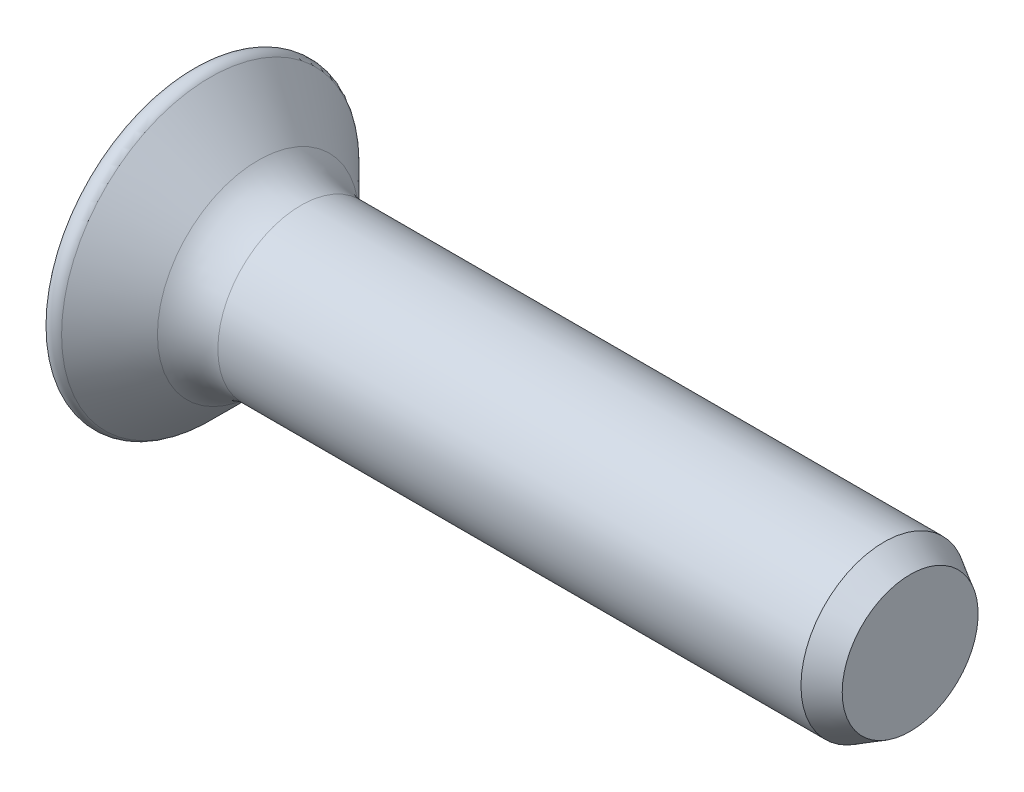
from build123d import *

# Parameters (mm, degrees)
CHAMFER1_SIZE      = 0.2
CHAMFER1_SIZE2     = 0.346410162
CUT_EXTRUDE1_DEPTH = 0.8
CUT_EXTRUDE1_TAPER = 6
FILLET1_R          = 0.8


with BuildPart() as part:
    # Sketch1 → Revolve1 (revolve)
    with BuildSketch(Plane.XY):
        with BuildLine():
            Line((-1.6, 0), (8.4, 0))
            Line((8.4, 0), (8.4, 1.1))
            Line((8.4, 1.1), (0, 1.1))
            Line((0, 1.1), (-0.869043005, 1.969043005))
            ThreePointArc((-0.869043005, 1.969043005), (-0.992640239, 2.010371092), (-1.1, 1.936491673))
            ThreePointArc((-1.1, 1.936491673), (-1.472983346, 1), (-1.6, 0))
        make_face()
    revolve(axis=Axis((0, 0, 0), (1, 0, 0)))

    # Chamfer1
    chamfer1_edges = [part.edges().sort_by_distance(p)[0] for p in [
        (8.4, -1.1, 0),
    ]]
    chamfer1_side = [part.faces().sort_by_distance(p)[0] for p in [
        (8.4, 0, 0),
    ]]
    chamfer(chamfer1_edges, length=CHAMFER1_SIZE, length2=CHAMFER1_SIZE2, reference=chamfer1_side[0])

    # Sketch3 → Cut-Extrude1 (cut)
    with BuildSketch(Plane(origin=(-1.6, 0, 0), x_dir=(0, 0, -1), z_dir=(1, 0, 0))):
        Polygon((-0.22, 1.1), (-0.146666667, 0.733333333), (-0.36140157, 0.36140157), (-0.733333333, 0.146666667), (-1.1, 0.22), (-1.1, -0.22), (-0.733333333, -0.146666667), (-0.36140157, -0.36140157), (-0.146666667, -0.733333333), (-0.22, -1.1), (0.22, -1.1), (0.146666667, -0.733333333), (0.36140157, -0.36140157), (0.733333333, -0.146666667), (1.1, -0.22), (1.1, 0.22), (0.733333333, 0.146666667), (0.36140157, 0.36140157), (0.146666667, 0.733333333), (0.22, 1.1), align=None)
    extrude(amount=CUT_EXTRUDE1_DEPTH, taper=CUT_EXTRUDE1_TAPER, mode=Mode.SUBTRACT)

    # Fillet1
    fillet1_edges = [part.edges().sort_by_distance(p)[0] for p in [
        (0, -1.1, 0),
    ]]
    fillet(fillet1_edges, radius=FILLET1_R)


solid = part.part
